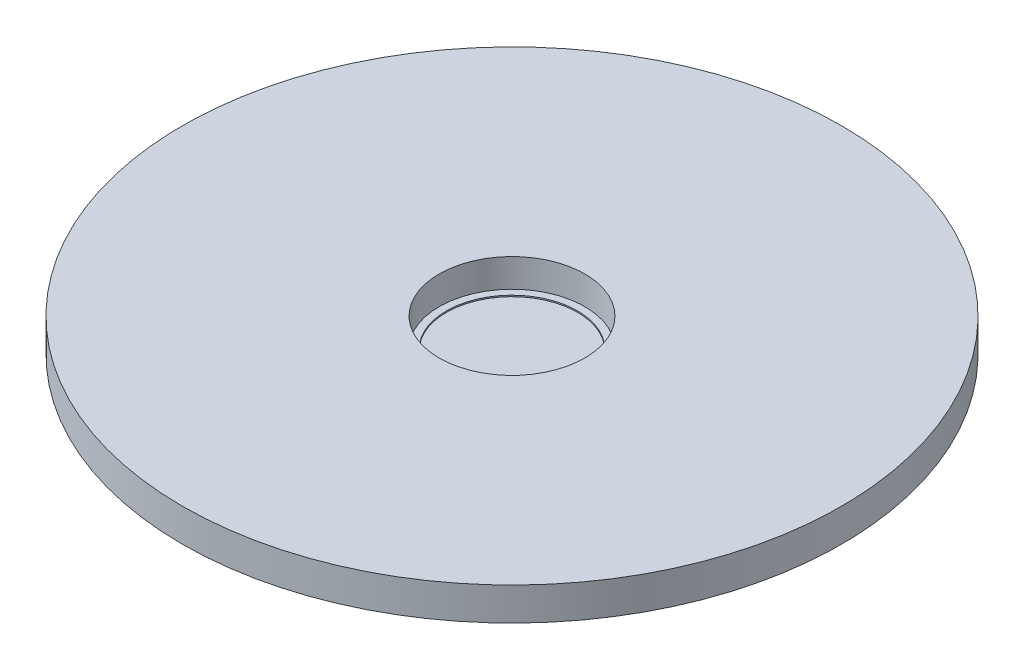
from build123d import *

# Parameters (mm, degrees)
SKETCH1_R           = 50
BOSS_EXTRUDE1_DEPTH = 5
SKETCH4_R           = 11.05
CUT_EXTRUDE2_DEPTH  = 4.5
BOSS_EXTRUDE4_START = 0.2
SKETCH5_R           = 11.05
SKETCH5_R_2         = 9.95
BOSS_EXTRUDE4_DEPTH = 0.2


with BuildPart() as part:
    # Sketch1 → Boss-Extrude1 (new body)
    with BuildSketch(Plane(origin=(0, 0, 0), x_dir=(1, 0, 0), z_dir=(0, 1, 0))):
        Circle(SKETCH1_R)
    extrude(amount=BOSS_EXTRUDE1_DEPTH)

    # Sketch4 → Cut-Extrude2 (cut)
    with BuildSketch(Plane(origin=(0, 5, 0), x_dir=(1, 0, 0), z_dir=(0, 1, 0))):
        Circle(SKETCH4_R)
    extrude(amount=-CUT_EXTRUDE2_DEPTH, mode=Mode.SUBTRACT)

    # Sketch5 → Boss-Extrude4 (add)
    with BuildSketch(Plane(origin=(0, 0.5, 0), x_dir=(1, 0, 0), z_dir=(0, 1, 0)).offset(BOSS_EXTRUDE4_START)):
        Circle(SKETCH5_R)
        Circle(SKETCH5_R_2, mode=Mode.SUBTRACT)
    extrude(amount=-BOSS_EXTRUDE4_DEPTH)


solid = part.part
